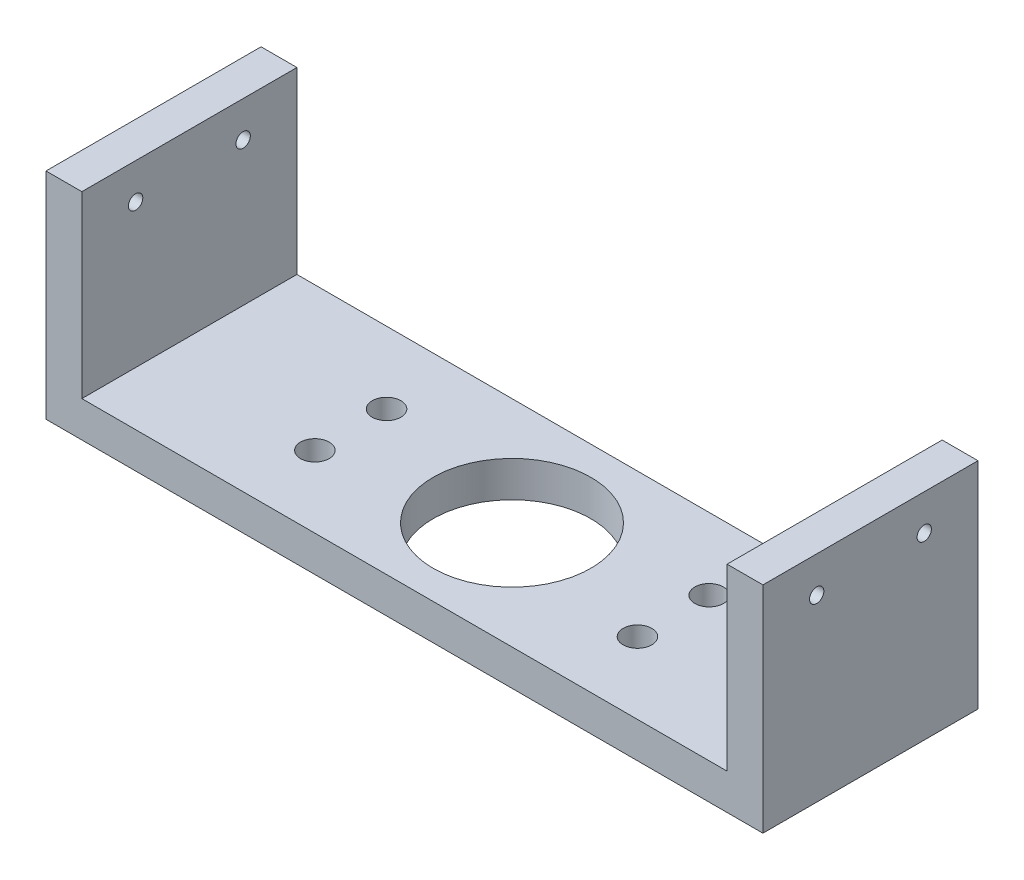
from build123d import *

# Parameters (mm, degrees)
SKETCH2_W           = 100
SKETCH2_H           = 30
SKETCH2_R           = 11
BOSS_EXTRUDE1_DEPTH = 5
SKETCH3_W           = 5
SKETCH3_H           = 30
BOSS_EXTRUDE2_DEPTH = 25
SKETCH4_R           = 1
CUT_EXTRUDE1_DEPTH  = 106.475115549
SKETCH5_R           = 2
CUT_EXTRUDE2_DEPTH  = 10


with BuildPart() as part:
    # Sketch2 → Boss-Extrude1 (new body)
    with BuildSketch(Plane(origin=(0, 0, 0), x_dir=(1, 0, 0), z_dir=(0, 1, 0))):
        Rectangle(SKETCH2_W, SKETCH2_H)
        Circle(SKETCH2_R, mode=Mode.SUBTRACT)
    extrude(amount=BOSS_EXTRUDE1_DEPTH)

    # Sketch3 → Boss-Extrude2 (add)
    with BuildSketch(Plane(origin=(0, 5, 0), x_dir=(1, 0, 0), z_dir=(0, 1, 0))):
        with Locations((-47.5, 0)):
            Rectangle(SKETCH3_W, SKETCH3_H)
        with Locations((47.5, 0)):
            Rectangle(SKETCH3_W, SKETCH3_H)
    extrude(amount=BOSS_EXTRUDE2_DEPTH)

    # Sketch4 → Cut-Extrude1 (cut, through all)
    with BuildSketch(Plane(origin=(50, 0, 0), x_dir=(0, 0, -1), z_dir=(1, 0, 0))):
        with Locations((-7.5, 25)):
            Circle(SKETCH4_R)
        with Locations((7.5, 25)):
            Circle(SKETCH4_R)
    extrude(amount=-CUT_EXTRUDE1_DEPTH, mode=Mode.SUBTRACT)

    # Sketch5 → Cut-Extrude2 (cut)
    with BuildSketch(Plane.XZ):
        with Locations((-22.5, -5)):
            Circle(SKETCH5_R)
        with Locations((22.5, -5)):
            Circle(SKETCH5_R)
        with Locations((-22.5, 5)):
            Circle(SKETCH5_R)
        with Locations((22.5, 5)):
            Circle(SKETCH5_R)
    extrude(amount=-CUT_EXTRUDE2_DEPTH, mode=Mode.SUBTRACT)


solid = part.part
